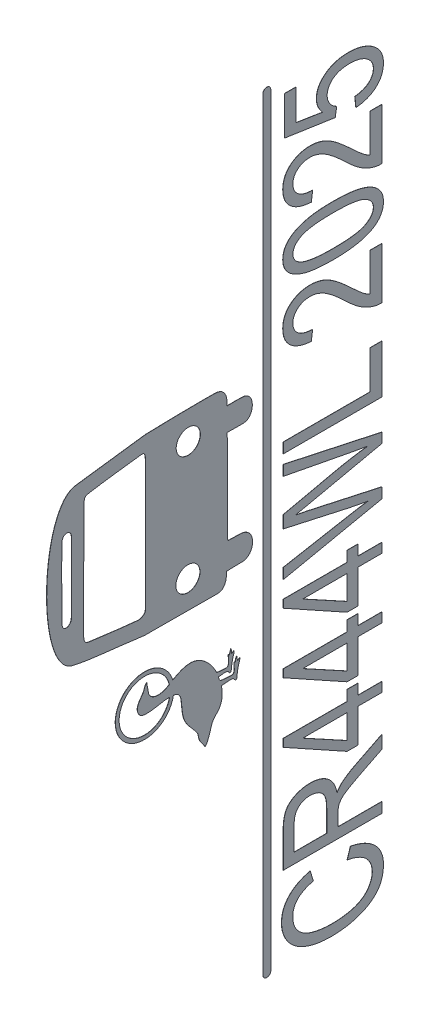
from build123d import *

# Parameters (mm, degrees)
BOSS_EXTRUDE1_DEPTH    = 0.2
BOSS_EXTRUDE1_2_DEPTH  = 0.2
BOSS_EXTRUDE1_3_DEPTH  = 0.2
BOSS_EXTRUDE1_4_DEPTH  = 0.2
BOSS_EXTRUDE1_5_DEPTH  = 0.2
BOSS_EXTRUDE1_6_DEPTH  = 0.2
BOSS_EXTRUDE1_7_DEPTH  = 0.2
BOSS_EXTRUDE1_8_DEPTH  = 0.2
BOSS_EXTRUDE1_9_DEPTH  = 0.2
BOSS_EXTRUDE1_10_DEPTH = 0.2
BOSS_EXTRUDE1_11_DEPTH = 0.2
BOSS_EXTRUDE1_12_DEPTH = 0.2
BOSS_EXTRUDE1_13_DEPTH = 0.2
BOSS_EXTRUDE1_14_DEPTH = 0.2
SKETCH4_R              = 32.916483783
SKETCH4_R_2            = 28.662777942
BOSS_EXTRUDE2_DEPTH    = 0.2


with BuildPart() as part:
    # Sketch3 → Boss-Extrude1 (new body)
    with BuildSketch(Plane.YZ):
        Polygon((443.756376, 375.937768), (444.326672, 377.836394), (445.107423, 379.668885), (446.091733, 381.435439), (447.272703, 383.136254), (448.64344, 384.771528), (450.197045, 386.341459), (451.926623, 387.846243), (453.825278, 389.286079), (458.10223, 391.971695), (462.972731, 394.39989), (468.381609, 396.572243), (474.273695, 398.490337), (480.593817, 400.155751), (487.286804, 401.570068), (494.297485, 402.734868), (501.570689, 403.651732), (509.051246, 404.322242), (516.683984, 404.747978), (524.413732, 404.930522), (532.18532, 404.871454), (539.943577, 404.572357), (547.633331, 404.03481), (555.199412, 403.260395), (562.586648, 402.250693), (569.73987, 401.007285), (576.603905, 399.531752), (583.123584, 397.825676), (589.243734, 395.890637), (594.909186, 393.728217), (600.064768, 391.339996), (604.655309, 388.727555), (608.625638, 385.892476), (610.360983, 384.391942), (611.920585, 382.836341), (613.297549, 381.22587), (614.484979, 379.560728), (615.475977, 377.841113), (616.263648, 376.067221), (616.841094, 374.239251), (617.201421, 372.3574), (627.544415, 294.187736), (627.859784, 282.299225), (628.435155, 255.655982), (628.714423, 227.791441), (628.569235, 217.630382), (628.395024, 214.232765), (628.141483, 212.239037), (627.447731, 210.125023), (626.499903, 208.327865), (625.339233, 206.82266), (624.006955, 205.584507), (622.544301, 204.588506), (620.992507, 203.809754), (619.392806, 203.223352), (617.786431, 202.804397), (614.718598, 202.369225), (612.118877, 202.305028), (609.643256, 202.492723), (609.678871, 195.542638), (609.627256, 189.527208), (609.443909, 184.193454), (609.016308, 181.741309), (608.103299, 179.627707), (606.774942, 177.849456), (605.101294, 176.40336), (603.152416, 175.286227), (600.998365, 174.49486), (598.709202, 174.026068), (596.354984, 173.876655), (594.005772, 174.043428), (591.731623, 174.523192), (589.602598, 175.312753), (587.688754, 176.408918), (586.060151, 177.808493), (584.786848, 179.508283), (583.938903, 181.505094), (583.586377, 183.795732), (583.624058, 194.802636), (583.785723, 202.095196), (477.968197, 201.498128), (477.570476, 187.376003), (477.451013, 185.68587), (477.176787, 184.107596), (476.758351, 182.640778), (476.206255, 181.285016), (475.531054, 180.039906), (474.7433, 178.905047), (472.872344, 176.96447), (470.677808, 175.460069), (468.244115, 174.388624), (465.655685, 173.746919), (462.996939, 173.531736), (460.352301, 173.739857), (457.80619, 174.368065), (455.44303, 175.413141), (453.34724, 176.871868), (451.603244, 178.741029), (450.889549, 179.828516), (450.295461, 181.017405), (449.831532, 182.307294), (449.508315, 183.69778), (449.336362, 185.188461), (449.326226, 186.778935), (449.178782, 195.970505), (448.928505, 202.89025), (446.330175, 202.850893), (443.665046, 203.054208), (440.607302, 203.630641), (439.052613, 204.111384), (437.545465, 204.748534), (436.134424, 205.563134), (434.868056, 206.576228), (433.794925, 207.808856), (432.963596, 209.282063), (432.422635, 211.016891), (432.220607, 213.034383), (432.618328, 295.182039), (435.945517, 321.505603), (438.444145, 342.92638), (439.60155, 352.179333), (440.814377, 360.66392), (442.170145, 368.532584), align=None)
        Polygon((463.437767, 259.875642), (461.402832, 259.723182), (459.445853, 259.277884), (457.593957, 258.557875), (455.87427, 257.58128), (454.313917, 256.366223), (452.940025, 254.930829), (451.779721, 253.293224), (450.86013, 251.471533), (450.222249, 249.533155), (449.884747, 247.554734), (449.841258, 245.56827), (450.085419, 243.605759), (450.610865, 241.699198), (451.41123, 239.880587), (452.48015, 238.181921), (453.811261, 236.635199), (455.357983, 235.304089), (457.056648, 234.235168), (458.87526, 233.434803), (460.78182, 232.909358), (462.744331, 232.665197), (464.730796, 232.708685), (466.709216, 233.046188), (468.647595, 233.684069), (470.469286, 234.60366), (472.106891, 235.763964), (473.542284, 237.137855), (474.757341, 238.698208), (475.733937, 240.417896), (476.453946, 242.269792), (476.899243, 244.226771), (477.051703, 246.261706), (476.775116, 249.005389), (475.981853, 251.560864), (474.726657, 253.873387), (473.064274, 255.888212), (471.049448, 257.550595), (468.736926, 258.805791), (466.18145, 259.599055), align=None, mode=Mode.SUBTRACT)
        Polygon((597.00244, 259.477726), (594.967505, 259.325266), (593.010526, 258.879968), (591.15863, 258.15996), (589.438943, 257.183364), (587.87859, 255.968307), (586.504698, 254.532913), (585.344394, 252.895308), (584.424803, 251.073618), (583.786922, 249.135239), (583.44942, 247.156818), (583.405931, 245.170354), (583.650092, 243.207843), (584.175538, 241.301283), (584.975903, 239.482671), (586.044823, 237.784005), (587.375934, 236.237283), (588.922656, 234.906173), (590.621321, 233.837252), (592.439933, 233.036887), (594.346493, 232.511442), (596.309004, 232.267281), (598.295469, 232.310769), (600.273889, 232.648272), (602.212268, 233.286153), (604.033959, 234.205744), (605.671564, 235.366048), (607.106957, 236.73994), (608.322014, 238.300292), (609.29861, 240.01998), (610.018619, 241.871876), (610.463916, 243.828855), (610.616376, 245.86379), (610.339789, 248.607473), (609.546526, 251.162948), (608.29133, 253.475471), (606.628947, 255.490296), (604.614121, 257.152679), (602.301599, 258.407875), (599.746123, 259.201139), align=None, mode=Mode.SUBTRACT)
        Polygon((466.023637, 363.416918), (463.74308, 363.278021), (461.91338, 362.918698), (460.482175, 362.358834), (459.397102, 361.618408), (458.605799, 360.717399), (458.055902, 359.675789), (457.695049, 358.513556), (457.470876, 357.25068), (453.251504, 324.248725), (450.906917, 302.551928), (450.913772, 301.202651), (451.177742, 299.773829), (451.672292, 298.345256), (452.370889, 296.996725), (453.246998, 295.808028), (454.274083, 294.858958), (455.42561, 294.22931), (456.675045, 293.998875), (531.474069, 293.736685), (568.359211, 293.749312), (603.864739, 293.998875), (605.965892, 294.11635), (607.592165, 294.400509), (608.798046, 294.836473), (609.63802, 295.409364), (610.166577, 296.104301), (610.438201, 296.906406), (610.50738, 297.800799), (610.428601, 298.772602), (606.718548, 327.953369), (604.698336, 342.959181), (602.47252, 357.25068), (601.748802, 359.990497), (601.271685, 360.958182), (600.716565, 361.692567), (600.082569, 362.21979), (599.368825, 362.565986), (597.698599, 362.81985), (531.88803, 363.393373), (498.950601, 363.540275), align=None, mode=Mode.SUBTRACT)
        Polygon((489.89227, 387.683078), (488.343249, 387.559584), (487.027117, 387.220625), (485.940358, 386.697075), (485.079458, 386.019812), (484.440903, 385.219711), (484.021176, 384.327648), (483.816764, 383.374497), (483.82415, 382.391135), (484.039821, 381.408437), (484.460261, 380.45728), (485.081955, 379.568538), (485.901388, 378.773087), (486.915045, 378.101803), (488.119412, 377.585562), (489.510972, 377.255239), (491.086213, 377.141711), (569.852557, 377.141711), (571.242484, 377.26032), (572.451706, 377.58912), (573.479943, 378.098503), (574.326915, 378.758865), (574.992343, 379.5406), (575.475949, 380.414102), (575.777452, 381.349765), (575.896573, 382.317984), (575.833033, 383.289154), (575.586553, 384.233668), (575.156852, 385.121921), (574.543653, 385.924308), (573.746675, 386.611223), (572.76564, 387.15306), (571.600267, 387.520214), (570.250278, 387.683078), (550.23168, 388.079372), (529.537012, 388.057219), align=None, mode=Mode.SUBTRACT)
    extrude(amount=BOSS_EXTRUDE1_DEPTH)


with BuildPart() as body_2:
    # Sketch3 → Boss-Extrude1 2 (new body)
    with BuildSketch(Plane.YZ):
        Polygon((385.53766, 292.46256), (383.334112, 292.194214), (381.127625, 291.794639), (376.73736, 290.93867), (374.424615, 290.594236), (373.28955, 290.318608), (372.2244, 289.86074), (370.325952, 288.491068), (368.874327, 286.843232), (367.834429, 284.972073), (367.17116, 282.932429), (366.849425, 280.779138), (366.834126, 278.567041), (367.090166, 276.350975), (367.58245, 274.18578), (368.779451, 271.012648), (370.394889, 267.930034), (373.93389, 262.0008), (375.527325, 259.048279), (376.968898, 256.027978), (378.194559, 252.944281), (379.14026, 249.801574), (379.741951, 246.60424), (379.935582, 243.356663), (379.657105, 240.063228), (378.84247, 236.72832), (377.824653, 234.141908), (376.529077, 231.654221), (374.992905, 229.274653), (373.253297, 227.012599), (371.347418, 224.877454), (369.312429, 222.878612), (367.185492, 221.02547), (365.00377, 219.32742), (361.814869, 217.148316), (358.45988, 215.23685), (356.82372, 214.4179), (356.155976, 213.842854), (355.78234, 213.03189), (355.302287, 208.98251), (355.05442, 204.9121), (354.966731, 203.041214), (355.184429, 202.175561), (355.78373, 201.41767), (356.805584, 200.855599), (358.084657, 200.548672), (359.54322, 200.439478), (361.103541, 200.470605), (364.21854, 200.724181), (366.80781, 200.85011), (366.13009, 199.72198), (366.13009, 199.49607), (371.09431, 198.14203), (371.09431, 197.69022), (365.90447, 197.01389), (367.93525, 194.30623), (366.51981, 194.33937), (365.086147, 194.635152), (362.29415, 195.46086), (357.584169, 196.56278), (352.81697, 197.36977), (350.318306, 197.517935), (349.008455, 197.795307), (348.539259, 198.057451), (348.2704, 198.42957), (348.233396, 198.942422), (348.449678, 199.408461), (349.359373, 200.254185), (350.434025, 201.074912), (350.856506, 201.509704), (351.10818, 201.97881), (351.341708, 203.130236), (351.422001, 204.349767), (351.2729, 206.90809), (350.960906, 209.483671), (350.78605, 211.9064), (348.342131, 211.267646), (347.113329, 210.744423), (346.24115, 210.0385), (345.887541, 209.306598), (345.711075, 208.438501), (345.56065, 206.71656), (344.85504, 198.81891), (344.732323, 196.94891), (344.920535, 196.059364), (345.43375, 195.26005), (346.333713, 194.630089), (347.463609, 194.275414), (348.756058, 194.135304), (350.143681, 194.149036), (352.934928, 194.39514), (355.29831, 194.52795), (356.002624, 194.383308), (356.346059, 194.0716), (356.278575, 193.650602), (355.75013, 193.17809), (355.75013, 192.95219), (357.104512, 192.874559), (358.531841, 192.634471), (359.865775, 192.15836), (360.93997, 191.37266), (355.75013, 190.47043), (357.78091, 187.98825), (356.359984, 187.936064), (354.829334, 188.226531), (351.91405, 189.11639), (347.32317, 190.232355), (342.66263, 190.98583), (340.13834, 191.140779), (338.818817, 191.438216), (338.349346, 191.713367), (338.08469, 192.10002), (338.068574, 192.6074), (338.308874, 193.080227), (339.263724, 193.971797), (340.359242, 194.873879), (340.775377, 195.359845), (341.00543, 195.88562), (341.209535, 197.360526), (341.262953, 198.917628), (341.059641, 202.173791), (340.679316, 205.444859), (340.4058, 208.52158), (335.055744, 207.907247), (332.458942, 207.772523), (329.901448, 207.824042), (327.37363, 208.115266), (324.865857, 208.699656), (322.368498, 209.630674), (319.87192, 210.96178), (318.404117, 211.990426), (317.050647, 213.130649), (314.490906, 215.533765), (313.186732, 216.690627), (311.801087, 217.747004), (310.28502, 218.64988), (308.58958, 219.34624), (301.765863, 221.510621), (298.390398, 222.678399), (295.0507, 223.99628), (292.377059, 225.133084), (291.175076, 225.928469), (290.31211, 227.02468), (292.717464, 228.5351), (294.986845, 230.224477), (297.288153, 231.875916), (299.78929, 233.27252), (302.03776, 233.995647), (304.280425, 234.424377), (306.477595, 234.972361), (307.546716, 235.420339), (308.58958, 236.05325), (311.155352, 238.02762), (313.661519, 240.128229), (318.663148, 244.39515), (321.242664, 246.404955), (323.930685, 248.227986), (326.769238, 249.785989), (329.80035, 251.00071), (334.060172, 252.085842), (338.411888, 252.753675), (347.17518, 253.61369), (349.819314, 253.957766), (352.3295, 254.587299), (353.494431, 255.08802), (354.577958, 255.754797), (355.564109, 256.619192), (356.43691, 257.71277), (357.064001, 258.797663), (357.546517, 259.926108), (358.152974, 262.283551), (358.406584, 264.724899), (358.45765, 267.18995), (358.344504, 269.96453), (358.043759, 272.729762), (357.109156, 278.24493), (356.113213, 283.760961), (355.735792, 286.52727), (355.5153, 289.30336), (355.402721, 292.213636), (355.532939, 295.21476), (355.792751, 296.673471), (356.237647, 298.063791), (356.90909, 299.355353), (357.84854, 300.51779), (359.292509, 301.630759), (360.93969, 302.41888), (362.261093, 302.828213), (363.517403, 303.059015), (364.71544, 303.12687), (365.862019, 303.047357), (368.028076, 302.508557), (370.070115, 301.567271), (372.042676, 300.348152), (374.000299, 298.975853), (375.997523, 297.575028), (378.08889, 296.27033), (379.975252, 295.495935), (382.173016, 294.770655), (384.190318, 293.843235), (384.977587, 293.225206), (385.53529, 292.46242), align=None)
    extrude(amount=BOSS_EXTRUDE1_2_DEPTH)

    # Sketch4 → Boss-Extrude2 (add)
    with BuildSketch(Plane.YZ):
        with Locations((364.164378919, 294.917307298)):
            Circle(SKETCH4_R)
        with Locations((364.164378919, 294.917307298)):
            Circle(SKETCH4_R_2, mode=Mode.SUBTRACT)
    extrude(amount=BOSS_EXTRUDE2_DEPTH)


with BuildPart() as body_3:
    # Sketch3 → Boss-Extrude1 3 (new body)
    with BuildSketch(Plane.YZ):
        Polygon((100.150272, 67.221695), (111.68162, 63.522907), (110.684143, 59.145931), (109.504631, 55.035513), (108.143085, 51.191652), (106.599504, 47.61435), (104.873888, 44.303605), (102.966238, 41.259417), (100.876553, 38.481788), (98.604834, 35.970716), (96.191013, 33.759226), (93.64531, 31.842602), (90.967725, 30.220843), (88.158257, 28.893949), (85.216908, 27.86192), (82.143676, 27.124757), (78.938562, 26.682459), (75.601566, 26.535026), (72.161479, 26.648255), (68.884851, 26.987939), (65.771683, 27.55408), (62.821975, 28.346677), (60.035727, 29.365731), (57.412939, 30.61124), (54.95361, 32.083207), (52.657742, 33.781629), (50.523476, 35.713586), (48.519235, 37.848411), (46.645019, 40.186102), (44.900827, 42.726661), (43.286661, 45.470086), (41.802519, 48.416379), (40.448403, 51.565539), (39.224311, 54.917566), (38.151606, 58.402872), (37.221927, 61.951869), (36.435277, 65.564557), (35.791653, 69.240936), (34.933489, 76.784767), (34.647434, 84.583363), (34.728235, 88.835319), (34.970639, 92.948098), (35.374645, 96.921701), (35.940253, 100.756127), (36.667464, 104.451377), (37.556277, 108.007451), (38.606693, 111.424348), (39.818711, 114.702069), (41.194189, 117.831177), (42.705264, 120.764495), (44.351937, 123.502023), (46.134207, 126.043761), (48.052074, 128.389709), (50.105539, 130.539867), (52.294601, 132.494235), (54.61926, 134.252813), (57.056299, 135.827391), (59.552777, 137.192026), (62.108696, 138.346717), (64.724054, 139.291464), (67.398852, 140.026267), (70.13309, 140.551126), (72.926769, 140.866042), (75.779887, 140.971014), (78.984072, 140.838914), (82.058232, 140.442616), (85.002368, 139.782118), (87.816478, 138.857422), (90.500563, 137.668526), (93.054624, 136.215432), (95.478659, 134.498138), (97.772669, 132.516646), (99.917153, 130.29572), (101.892604, 127.860133), (103.699022, 125.209884), (105.336407, 122.344973), (106.804759, 119.265401), (108.104079, 115.971166), (109.234365, 112.462271), (110.195619, 108.738713), (98.842589, 105.341872), (97.155979, 110.970257), (96.184508, 113.47661), (95.127591, 115.777737), (93.98523, 117.873638), (92.757425, 119.764312), (91.444174, 121.449761), (90.045479, 122.929983), (88.557622, 124.221494), (86.97689, 125.340803), (85.303283, 126.287911), (83.536802, 127.062818), (81.677445, 127.665523), (79.725214, 128.096027), (77.680107, 128.354329), (75.542126, 128.44043), (73.081869, 128.344893), (70.723775, 128.058284), (68.467842, 127.580602), (66.314072, 126.911847), (64.262465, 126.05202), (62.31302, 125.001119), (60.465738, 123.759146), (58.720618, 122.3261), (57.103665, 120.73147), (55.611165, 119.004741), (54.243117, 117.145911), (52.999521, 115.154981), (51.880378, 113.031951), (50.885688, 110.776822), (50.01545, 108.389592), (49.269664, 105.870262), (48.073435, 100.694792), (47.218986, 95.4344), (46.706316, 90.089083), (46.535426, 84.658844), (46.736036, 77.822693), (47.337866, 71.430018), (48.340915, 65.480817), (49.745184, 59.975093), (50.618209, 57.434534), (51.602683, 55.059101), (52.698607, 52.848791), (53.905981, 50.803606), (55.224805, 48.923546), (56.655079, 47.20861), (58.196803, 45.658798), (59.849977, 44.274111), (61.576522, 43.053371), (63.33836, 41.995397), (65.13549, 41.100188), (66.967912, 40.367744), (68.835627, 39.798066), (70.738635, 39.391152), (72.676935, 39.147004), (74.650527, 39.065622), (77.026267, 39.176491), (79.309132, 39.509099), (81.499123, 40.063445), (83.596238, 40.839529), (85.600479, 41.837352), (87.511845, 43.056913), (89.330337, 44.498213), (91.055953, 46.161251), (92.667333, 48.042492), (94.143117, 50.138394), (95.483302, 52.448957), (96.687891, 54.974182), (97.756882, 57.714069), (98.690276, 60.668616), (99.488072, 63.837825), align=None)
    extrude(amount=BOSS_EXTRUDE1_3_DEPTH)


with BuildPart() as body_4:
    # Sketch3 → Boss-Extrude1 4 (new body)
    with BuildSketch(Plane.YZ):
        Polygon((126.06609, 28.422167), (126.06609, 139.083874), (164.702068, 139.083874), (170.177974, 138.89516), (174.955461, 138.32902), (179.034529, 137.385454), (180.812156, 136.772136), (182.415178, 136.064461), (183.892817, 135.25653), (185.294298, 134.304706), (186.619623, 133.208987), (187.86879, 131.969374), (190.138654, 129.058465), (192.103888, 125.571979), (193.690193, 121.69863), (194.823268, 117.627131), (195.503113, 113.357483), (195.729728, 108.889686), (195.635924, 106.003545), (195.354513, 103.232992), (194.885494, 100.578026), (194.228868, 98.038647), (193.384634, 95.614856), (192.352792, 93.306652), (191.133343, 91.114036), (189.726286, 89.037007), (188.123265, 87.109767), (186.315919, 85.366524), (184.304248, 83.807276), (182.088252, 82.432025), (179.667932, 81.240769), (177.043286, 80.23351), (174.214316, 79.410247), (171.18102, 78.77098), (175.208079, 75.996892), (176.809244, 74.624), (178.1355, 73.260544), (180.628263, 70.132611), (183.054156, 66.636689), (185.413178, 62.772776), (187.705329, 58.540873), (202.862518, 28.422167), (188.359175, 28.422167), (176.827817, 51.445232), (172.221221, 60.239296), (168.506226, 66.693305), (166.91249, 69.137147), (165.400485, 71.18469), (163.97021, 72.835935), (162.621666, 74.090881), (160.036031, 75.883662), (158.720922, 76.539441), (157.390951, 77.034813), (154.805312, 77.431114), (150.971435, 77.563215), (137.597448, 77.563215), (137.597448, 28.422167), align=None)
        Polygon((137.597448, 90.244772), (162.383911, 90.244772), (166.121196, 90.372155), (169.427543, 90.754301), (172.302953, 91.391211), (174.747424, 92.282886), (176.842682, 93.49065), (178.67046, 95.000358), (180.230758, 96.81201), (181.523577, 98.925606), (182.53777, 101.275089), (183.262195, 103.718929), (183.696849, 106.257129), (183.841734, 108.889686), (183.559394, 112.640369), (183.206469, 114.384791), (182.712374, 116.041932), (182.077108, 117.611794), (181.300673, 119.094375), (180.383068, 120.489677), (179.324293, 121.797699), (178.128064, 122.983056), (176.768375, 124.010366), (175.245227, 124.879629), (173.558618, 125.590844), (171.70855, 126.144011), (169.695022, 126.53913), (167.518034, 126.776201), (165.177587, 126.855225), (137.597448, 126.855225), align=None, mode=Mode.SUBTRACT)
    extrude(amount=BOSS_EXTRUDE1_4_DEPTH)


with BuildPart() as body_5:
    # Sketch3 → Boss-Extrude1 5 (new body)
    with BuildSketch(Plane.YZ):
        Polygon((243.757216, 28.422167), (243.757216, 54.917566), (205.953403, 54.917566), (205.953403, 67.372669), (245.718736, 139.083874), (254.456409, 139.083874), (254.456409, 67.372669), (266.225522, 67.372669), (266.225522, 54.917566), (254.456409, 54.917566), (254.456409, 28.422167), align=None)
        Polygon((243.757216, 67.372669), (243.757216, 117.268573), (216.474269, 67.372669), align=None, mode=Mode.SUBTRACT)
    extrude(amount=BOSS_EXTRUDE1_5_DEPTH)


with BuildPart() as body_6:
    # Sketch3 → Boss-Extrude1 6 (new body)
    with BuildSketch(Plane.YZ):
        Polygon((311.459334, 28.422167), (311.459334, 54.917566), (273.655512, 54.917566), (273.655512, 67.372669), (313.420845, 139.083874), (322.158518, 139.083874), (322.158518, 67.372669), (333.92763, 67.372669), (333.92763, 54.917566), (322.158518, 54.917566), (322.158518, 28.422167), align=None)
        Polygon((311.459334, 67.372669), (311.459334, 117.268573), (284.176386, 67.372669), align=None, mode=Mode.SUBTRACT)
    extrude(amount=BOSS_EXTRUDE1_6_DEPTH)


with BuildPart() as body_7:
    # Sketch3 → Boss-Extrude1 7 (new body)
    with BuildSketch(Plane.YZ):
        Polygon((379.161442, 28.422167), (379.161442, 54.917566), (341.357629, 54.917566), (341.357629, 67.372669), (381.122963, 139.083874), (389.860636, 139.083874), (389.860636, 67.372669), (401.629748, 67.372669), (401.629748, 54.917566), (389.860636, 54.917566), (389.860636, 28.422167), align=None)
        Polygon((379.161442, 67.372669), (379.161442, 117.268573), (351.878504, 67.372669), align=None, mode=Mode.SUBTRACT)
    extrude(amount=BOSS_EXTRUDE1_7_DEPTH)


with BuildPart() as body_8:
    # Sketch3 → Boss-Extrude1 8 (new body)
    with BuildSketch(Plane.YZ):
        Polygon((432.122453, 28.422167), (409.000301, 139.083874), (420.828859, 139.083874), (434.083965, 66.542332), (436.075203, 55.181764), (437.769241, 43.896683), (441.692282, 64.353256), (458.276036, 139.083874), (472.184978, 139.083874), (484.667373, 83.073651), (486.851792, 72.812344), (488.709291, 62.862414), (490.239869, 53.22386), (491.443526, 43.896683), (493.360466, 55.162891), (495.782648, 67.976551), (509.453836, 139.083874), (521.04463, 139.083874), (497.149768, 28.422167), (486.034493, 28.422167), (467.667546, 112.739448), (464.933307, 125.722952), (462.377386, 112.739448), (443.891566, 28.422167), align=None)
    extrude(amount=BOSS_EXTRUDE1_8_DEPTH)


with BuildPart() as body_9:
    # Sketch3 → Boss-Extrude1 9 (new body)
    with BuildSketch(Plane.YZ):
        Polygon((531.32775, 28.422167), (531.32775, 139.083874), (542.859099, 139.083874), (542.859099, 41.481152), (585.774753, 41.481152), (585.774753, 28.422167), align=None)
    extrude(amount=BOSS_EXTRUDE1_9_DEPTH)


with BuildPart() as body_10:
    # Sketch3 → Boss-Extrude1 10 (new body)
    with BuildSketch(Plane.YZ):
        Polygon((680.700355, 41.481152), (680.700355, 28.422167), (623.10303, 28.422167), (623.136468, 30.851854), (623.355655, 33.234363), (623.760591, 35.569693), (624.351277, 37.857845), (625.614374, 41.580225), (627.204391, 45.274297), (629.121328, 48.940061), (631.365184, 52.577516), (634.069703, 56.342353), (637.309182, 60.390261), (641.08362, 64.72124), (645.393017, 69.33529), (651.920269, 76.346008), (657.295871, 82.582998), (661.519824, 88.046261), (664.592129, 92.735795), (666.776545, 97.01488), (668.336842, 101.171299), (669.27302, 105.205052), (669.507065, 107.17593), (669.58508, 109.116141), (669.299025, 112.994209), (668.941456, 114.812938), (668.44086, 116.551463), (667.797237, 118.209785), (667.010586, 119.787903), (666.080908, 121.285817), (665.008202, 122.703528), (663.835193, 124.01273), (662.574881, 125.147372), (661.227266, 126.107453), (659.792349, 126.892974), (658.270129, 127.503935), (656.660606, 127.940336), (654.963781, 128.202176), (653.179653, 128.289456), (651.29615, 128.197459), (649.509237, 127.921465), (647.818914, 127.461476), (646.22518, 126.81749), (644.728035, 125.98951), (643.327481, 124.977533), (642.023515, 123.781561), (640.81614, 122.401592), (639.728575, 120.858856), (638.784038, 119.174585), (637.982528, 117.348779), (637.324045, 115.381439), (636.80859, 113.272563), (636.436162, 111.022153), (636.206762, 108.630208), (636.120389, 106.096728), (625.123996, 107.530948), (625.503853, 111.320554), (626.078748, 114.876626), (626.848681, 118.199166), (627.813651, 121.288173), (628.973658, 124.143647), (630.328703, 126.765587), (631.878785, 129.153995), (633.623905, 131.308869), (635.545487, 133.237289), (637.624957, 134.908587), (639.862314, 136.322761), (642.25756, 137.479813), (644.810692, 138.379742), (647.521713, 139.022549), (650.390621, 139.408233), (653.417417, 139.536794), (656.471145, 139.398797), (659.361412, 138.984806), (662.08822, 138.294821), (664.651568, 137.328842), (667.051455, 136.086869), (669.287882, 134.568903), (671.360849, 132.774942), (673.270356, 130.704987), (674.983899, 128.430988), (676.46897, 126.02489), (677.725568, 123.486691), (678.753694, 120.816393), (679.553347, 118.013996), (680.124528, 115.079499), (680.467237, 112.012902), (680.581473, 108.814205), (680.447733, 105.506994), (680.046514, 102.22809), (679.377814, 98.977495), (678.441635, 95.755208), (677.193396, 92.504615), (675.588518, 89.169102), (673.627001, 85.748668), (671.308845, 82.243314), (668.429719, 78.365245), (664.725865, 73.826681), (660.197283, 68.62762), (654.843973, 62.768062), (646.938458, 54.143845), (642.48046, 48.803247), (639.983982, 45.16107), (637.963028, 41.481152), align=None)
    extrude(amount=BOSS_EXTRUDE1_10_DEPTH)


with BuildPart() as body_11:
    # Sketch3 → Boss-Extrude1 11 (new body)
    with BuildSketch(Plane.YZ):
        Polygon((692.172294, 82.99817), (692.369189, 92.330062), (692.959874, 100.699514), (693.94435, 108.106525), (695.322615, 114.551096), (697.116959, 120.20779), (698.15623, 122.777835), (699.290233, 125.175678), (700.518969, 127.40132), (701.842437, 129.45476), (703.260638, 131.335999), (704.773571, 133.045036), (706.398882, 134.566542), (708.124498, 135.88518), (709.950419, 137.000951), (711.876644, 137.913855), (713.903175, 138.623891), (716.030011, 139.131059), (718.257151, 139.43536), (720.584597, 139.536794), (723.98382, 139.310337), (727.167572, 138.630967), (730.135854, 137.498684), (732.888665, 135.913487), (735.418579, 133.936712), (737.718163, 131.554203), (739.787416, 128.765958), (741.626338, 125.571979), (743.257224, 122.024159), (744.702359, 118.098913), (745.961745, 113.79624), (747.03538, 109.116141), (747.893545, 103.860464), (748.50652, 97.755576), (748.874305, 90.801478), (748.9969, 82.99817), (748.800005, 73.727606), (748.20932, 65.391177), (747.224844, 57.988884), (745.846579, 51.520725), (744.074523, 45.892335), (743.040825, 43.329366), (741.908679, 40.93388), (740.678086, 38.705878), (739.349046, 36.64536), (737.921558, 34.752325), (736.395623, 33.026773), (734.783314, 31.50527), (733.066985, 30.186634), (731.246636, 29.070865), (729.322268, 28.157963), (727.29388, 27.447928), (725.161472, 26.940761), (722.925044, 26.63646), (720.584597, 26.535026), (717.518796, 26.714304), (714.622027, 27.252138), (711.89429, 28.148528), (709.335585, 29.403474), (706.945912, 31.016977), (704.725271, 32.989035), (702.673662, 35.319649), (700.791085, 38.008819), (698.771056, 41.733555), (697.020364, 46.000844), (695.539009, 50.810684), (694.326992, 56.163077), (693.384311, 62.058022), (692.710968, 68.495519), (692.306963, 75.475568), align=None)
        Polygon((703.168688, 82.99817), (703.246703, 76.469853), (703.480748, 70.510037), (703.870822, 65.118722), (704.416927, 60.295907), (705.119062, 56.041593), (705.977227, 52.355779), (706.991422, 49.238465), (708.161647, 46.689652), (709.460968, 44.584316), (710.83273, 42.759691), (712.276935, 41.215777), (713.793583, 39.952575), (715.382673, 38.970085), (717.044205, 38.268306), (718.77818, 37.847239), (720.584597, 37.706883), (722.390085, 37.848418), (724.121274, 38.273024), (725.778163, 38.9807), (727.360752, 39.971446), (728.869041, 41.245262), (730.303031, 42.802149), (731.66272, 44.642106), (732.94811, 46.765134), (734.132266, 49.31277), (735.158534, 52.426547), (736.026914, 56.106465), (736.737407, 60.352524), (737.290013, 65.164724), (737.684732, 70.543065), (737.921563, 76.487547), (738.000506, 82.99817), (737.921563, 89.542995), (737.684732, 95.514603), (737.290013, 100.912994), (736.737407, 105.738167), (736.026914, 109.990123), (735.158534, 113.668862), (734.132266, 116.774383), (732.94811, 119.306687), (731.660863, 121.412024), (730.295601, 123.236649), (728.852323, 124.780562), (727.331031, 126.043764), (725.731725, 127.026254), (724.054403, 127.728033), (722.299066, 128.149101), (720.465715, 128.289456), (718.669514, 128.165613), (716.966188, 127.794083), (715.355737, 127.174866), (713.83816, 126.307962), (712.413459, 125.193371), (711.081632, 123.831094), (709.84268, 122.22113), (708.696603, 120.363479), (707.400997, 117.566978), (706.27814, 114.235002), (705.328029, 110.367551), (704.550666, 105.964625), (703.946051, 101.026223), (703.514182, 95.552347), (703.255061, 89.542996), align=None, mode=Mode.SUBTRACT)
    extrude(amount=BOSS_EXTRUDE1_11_DEPTH)


with BuildPart() as body_12:
    # Sketch3 → Boss-Extrude1 12 (new body)
    with BuildSketch(Plane.YZ):
        Polygon((816.104582, 41.481152), (816.104582, 28.422167), (758.507265, 28.422167), (758.5407, 30.851854), (758.759884, 33.234363), (759.164818, 35.569693), (759.755503, 37.857845), (761.018601, 41.580225), (762.60862, 45.274297), (764.525559, 48.940061), (766.76942, 52.577516), (769.473938, 56.342353), (772.713417, 60.390261), (776.487855, 64.72124), (780.797253, 69.33529), (787.3245, 76.346008), (792.7001, 82.582998), (796.924051, 88.046261), (799.996355, 92.735795), (802.180775, 97.01488), (803.741075, 101.171299), (804.677255, 105.205052), (804.9113, 107.17593), (804.989315, 109.116141), (804.70326, 112.994209), (804.345692, 114.812938), (803.845096, 116.551463), (803.201472, 118.209785), (802.414821, 119.787903), (801.485143, 121.285817), (800.412437, 122.703528), (799.239426, 124.01273), (797.979113, 125.147372), (796.631497, 126.107453), (795.19658, 126.892974), (793.67436, 127.503935), (792.064838, 127.940336), (790.368014, 128.202176), (788.583888, 128.289456), (786.700384, 128.197459), (784.913469, 127.921465), (783.223145, 127.461476), (781.62941, 126.81749), (780.132266, 125.98951), (778.731713, 124.977533), (777.427749, 123.781561), (776.220375, 122.401592), (775.132808, 120.858856), (774.188269, 119.174585), (773.386758, 117.348779), (772.728274, 115.381439), (772.212818, 113.272563), (771.840389, 111.022153), (771.610989, 108.630208), (771.524616, 106.096728), (760.528222, 107.530948), (760.90808, 111.320554), (761.482975, 114.876626), (762.252909, 118.199166), (763.21788, 121.288173), (764.377888, 124.143647), (765.732934, 126.765587), (767.283018, 129.153995), (769.02814, 131.308869), (770.949722, 133.237289), (773.029192, 134.908587), (775.266548, 136.322761), (777.661793, 137.479813), (780.214924, 138.379742), (782.925943, 139.022549), (785.794849, 139.408233), (788.821643, 139.536794), (791.875371, 139.398797), (794.765639, 138.984806), (797.492448, 138.294821), (800.055796, 137.328842), (802.455685, 136.086869), (804.692114, 134.568903), (806.765083, 132.774942), (808.674592, 130.704987), (810.388135, 128.430988), (811.873205, 126.02489), (813.129803, 123.486691), (814.157929, 120.816393), (814.957583, 118.013996), (815.528764, 115.079499), (815.871472, 112.012902), (815.985708, 108.814205), (815.851969, 105.506994), (815.450749, 102.22809), (814.782049, 98.977495), (813.84587, 95.755208), (812.59763, 92.504615), (810.992751, 89.169102), (809.031231, 85.748668), (806.713071, 82.243314), (803.833949, 78.365245), (800.130096, 73.826681), (795.601513, 68.62762), (790.248199, 62.768062), (782.342686, 54.143845), (777.884695, 48.803247), (775.388215, 45.16107), (773.367254, 41.481152), align=None)
    extrude(amount=BOSS_EXTRUDE1_12_DEPTH)


with BuildPart() as body_13:
    # Sketch3 → Boss-Extrude1 13 (new body)
    with BuildSketch(Plane.YZ):
        Polygon((827.576529, 57.408589), (838.810678, 58.616354), (839.639122, 53.728672), (840.876216, 49.482614), (841.648007, 47.600194), (842.521961, 45.878181), (843.498078, 44.316573), (844.576357, 42.915372), (845.749367, 41.694632), (846.97996, 40.636658), (848.268136, 39.741449), (849.613894, 39.009005), (851.017234, 38.439327), (852.478157, 38.032414), (853.996662, 37.788266), (855.57275, 37.706883), (857.467398, 37.82247), (859.287746, 38.169232), (861.033794, 38.747167), (862.705542, 39.556277), (864.30299, 40.596561), (865.826139, 41.86802), (867.274988, 43.370652), (868.649537, 45.104459), (869.903349, 47.029339), (870.989985, 49.105189), (871.909447, 51.332011), (872.661734, 53.709803), (873.246846, 56.238567), (873.664784, 58.918302), (873.915546, 61.749007), (873.999133, 64.730684), (873.918332, 67.56021), (873.675929, 70.236406), (873.271922, 72.759273), (872.706314, 75.128808), (871.979103, 77.345014), (871.090289, 79.40789), (870.039874, 81.317435), (868.827855, 83.073651), (867.499744, 84.648232), (866.071328, 86.012869), (864.542607, 87.167562), (862.913581, 88.11231), (861.184249, 88.847115), (859.354612, 89.371975), (857.42467, 89.686891), (855.394423, 89.791863), (852.871942, 89.603149), (850.47577, 89.037007), (848.205905, 88.093437), (846.062349, 86.772439), (844.093402, 85.187245), (842.347354, 83.375595), (840.824207, 81.337489), (839.52396, 79.072927), (829.478604, 80.733601), (837.919077, 137.574173), (881.250832, 137.574173), (881.250832, 124.590668), (846.478431, 124.590668), (841.782672, 94.84939), (843.756266, 96.477044), (845.754007, 97.887677), (847.775895, 99.08129), (849.82193, 100.057882), (851.892113, 100.817454), (853.986443, 101.360005), (856.10492, 101.685536), (858.247544, 101.794046), (861.044938, 101.637178), (863.730882, 101.166573), (866.305376, 100.382233), (868.768421, 99.284156), (871.120016, 97.872342), (873.36016, 96.146793), (875.488855, 94.107507), (877.506101, 91.754485), (879.34503, 89.154953), (880.938769, 86.376143), (882.287317, 83.418055), (883.390675, 80.280689), (884.248842, 76.964046), (884.861818, 73.468125), (885.229604, 69.792926), (885.352199, 65.938449), (885.244463, 62.246738), (884.921256, 58.682408), (884.382576, 55.24546), (883.628425, 51.935893), (882.658802, 48.753708), (881.473707, 45.698904), (880.073141, 42.771481), (878.457103, 39.97144), (876.266189, 36.822281), (873.883952, 34.093009), (871.310392, 31.783625), (868.54551, 29.89413), (865.589304, 28.424522), (862.441776, 27.374802), (859.102924, 26.74497), (855.57275, 26.535026), (852.66855, 26.667126), (849.899948, 27.063425), (847.266943, 27.723923), (844.769536, 28.648621), (842.407727, 29.837518), (840.181515, 31.290615), (838.090901, 33.00791), (836.135884, 34.989406), (834.36383, 37.189098), (832.792386, 39.560993), (831.421552, 42.105088), (830.251328, 44.821385), (829.281713, 47.709884), (828.512709, 50.770584), (827.944314, 54.003486), align=None)
    extrude(amount=BOSS_EXTRUDE1_13_DEPTH)


with BuildPart() as body_14:
    # Sketch3 → Boss-Extrude1 14 (new body)
    with BuildSketch(Plane.YZ):
        with BuildLine():
            Line((35.374645, 161.901439258), (893.086301434, 161.901439258))
            ThreePointArc((893.086301434, 161.901439258), (897.470754037, 157.516986655), (893.086301434, 153.132534052))
            Line((893.086301434, 153.132534052), (35.374645, 153.132534052))
            ThreePointArc((35.374645, 153.132534052), (30.990192397, 157.516986655), (35.374645, 161.901439258))
        make_face()
    extrude(amount=BOSS_EXTRUDE1_14_DEPTH)


solid = Compound([part.part, body_2.part, body_3.part, body_4.part, body_5.part, body_6.part, body_7.part, body_8.part, body_9.part, body_10.part, body_11.part, body_12.part, body_13.part, body_14.part])
